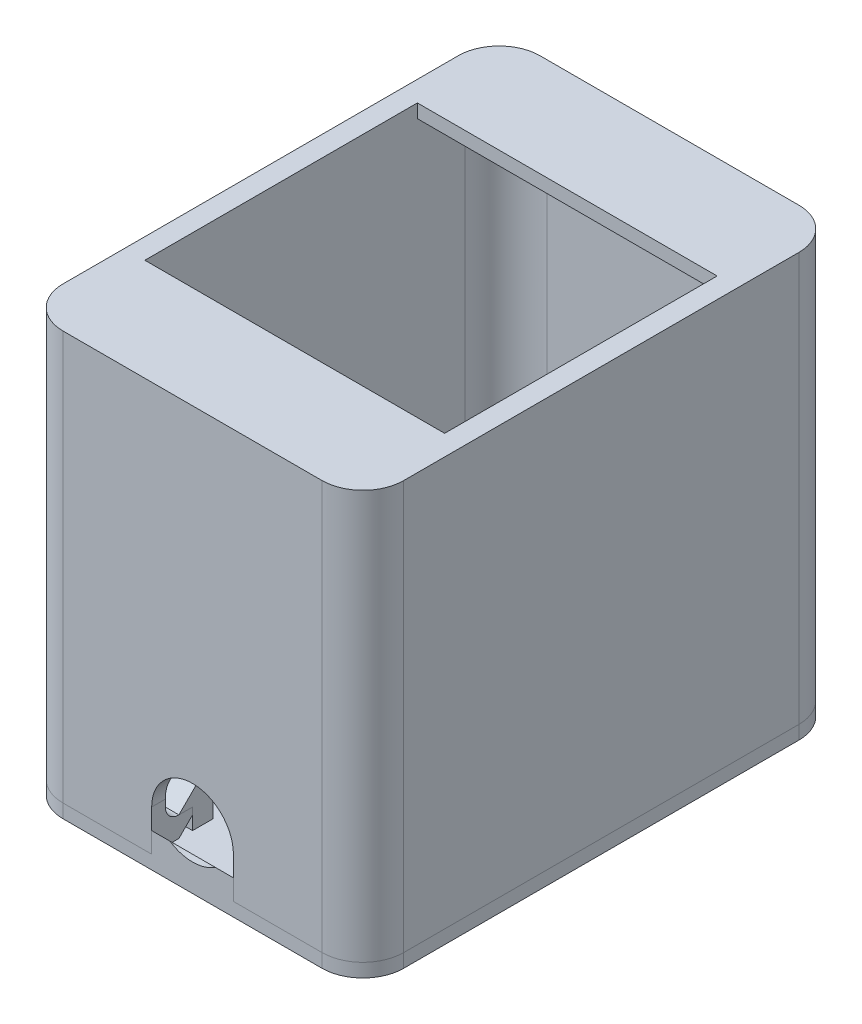
from build123d import *

# Parameters (mm, degrees)
SZKIC1_W                      = 25
SZKIC1_H                      = 35
SZKIC1_W_2                    = 22
SZKIC1_H_2                    = 20
DODANIE_WYCI_GNI_CIE1_DEPTH   = 30
SZKIC2_W                      = 22
SZKIC2_H                      = 4.5
WYTNIJ_WYCI_GNI_CIE1_DEPTH    = 28
SZKIC5_W                      = 22
SZKIC5_H                      = 26.5
WYTNIJ_WYCI_GNI_CIE2_DEPTH    = 2
DODANIE_WYCI_GNI_CIE2_DEPTH   = 22
DODANIE_WYCI_GNI_CIE2_2_DEPTH = 22
SZKIC7_W                      = 25
SZKIC7_H                      = 35
DODANIE_WYCI_GNI_CIE3_DEPTH   = 1
WYTNIJ_WYCI_GNI_CIE3_DEPTH    = 11
WYTNIJ_WYCI_GNI_CIE4_DEPTH    = 11
SZKIC10_W                     = 12
SZKIC10_H                     = 6.631969937
SZKIC10_W_2                   = 6
SZKIC10_H_2                   = 4.921641175
WYTNIJ_WYCI_GNI_CIE5_DEPTH    = 11
DODANIE_WYCI_GNI_CIE5_DEPTH   = 1
DODANIE_WYCI_GNI_CIE6_DEPTH   = 1
SFAZOWANIE1_SIZE              = 1
SFAZOWANIE2_SIZE              = 1
ZAOKR_GLENIE1_R               = 1
ZAOKR_GLENIE2_R               = 3
ZAOKR_GLENIE3_R               = 3
SFAZOWANIE3_SIZE              = 1
ZAOKR_GLENIE4_DEPTH           = 29
WYTNIJ_WYCI_GNI_CIE7_DEPTH    = 4


with BuildPart() as part:
    # Szkic1 → Dodanie-wyciągnięcie1 (new body)
    with BuildSketch(Plane(origin=(0, 0, 0), x_dir=(1, 0, 0), z_dir=(0, 1, 0))):
        Rectangle(SZKIC1_W, SZKIC1_H)
        Rectangle(SZKIC1_W_2, SZKIC1_H_2, mode=Mode.SUBTRACT)
    extrude(amount=DODANIE_WYCI_GNI_CIE1_DEPTH)

    # Szkic2 → Wytnij-wyciągnięcie1 (cut)
    with BuildSketch(Plane.XZ):
        with Locations((0, 12.25)):
            Rectangle(SZKIC2_W, SZKIC2_H)
        with Locations((0, -12.25)):
            Rectangle(SZKIC2_W, SZKIC2_H)
    extrude(amount=-WYTNIJ_WYCI_GNI_CIE1_DEPTH, mode=Mode.SUBTRACT)

    # Szkic5 → Wytnij-wyciągnięcie2 (cut)
    with BuildSketch(Plane(origin=(0, 0, 14.5), x_dir=(-1, 0, 0), z_dir=(0, 0, -1))):
        with Locations((0, 14.75)):
            Rectangle(SZKIC5_W, SZKIC5_H)
    wytnij_wyci_gni_cie2 = extrude(amount=-WYTNIJ_WYCI_GNI_CIE2_DEPTH, mode=Mode.SUBTRACT)

    # Lustro1: Wytnij-wyciągnięcie2 across plane
    add(wytnij_wyci_gni_cie2.mirror(Plane.XY), mode=Mode.SUBTRACT)


with BuildPart() as body_2:
    # Szkic6 → Dodanie-wyciągnięcie2 (new body)
    with BuildSketch(Plane(origin=(-11, 0, 0), x_dir=(0, 0, -1), z_dir=(1, 0, 0))):
        Polygon((-14.5, 1.5), (-15.5, 1.5), (-13, 4), (-13, 0), (-14.5, 0), align=None)
    extrude(amount=DODANIE_WYCI_GNI_CIE2_DEPTH)



with BuildPart() as body_3:
    # Szkic6 → Dodanie-wyci_gni_cie2 2 (new body)
    with BuildSketch(Plane(origin=(-11, 0, 0), x_dir=(0, 0, -1), z_dir=(1, 0, 0))):
        Polygon((14.5, 1.5), (15.5, 1.5), (13, 4), (13, 0), (14.5, 0), align=None)
    extrude(amount=DODANIE_WYCI_GNI_CIE2_2_DEPTH)


with BuildPart() as body_2_1:
    add(body_2.part)

    add(body_3.part)  # Dodanie-wyciągnięcie3 merges body 3
    # Szkic7 → Dodanie-wyciągnięcie3 (add)
    with BuildSketch(Plane.XZ):
        Rectangle(SZKIC7_W, SZKIC7_H)
    extrude(amount=DODANIE_WYCI_GNI_CIE3_DEPTH)


with BuildPart() as wytnij_wyci_gni_cie3_tool:
    # Szkic8 → Wytnij-wyciągnięcie3 (new body)
    with BuildSketch(Plane.XY.offset(17.5)):
        with BuildLine():
            Line((3, 3), (3, 0))
            Line((3, 0), (-3, 0))
            Line((-3, 0), (-3, 3))
            ThreePointArc((-3, 3), (0, 6), (3, 3))
        make_face()
    extrude(amount=-WYTNIJ_WYCI_GNI_CIE3_DEPTH)


with BuildPart() as part_1:
    add(part.part)

    # Wytnij-wyciągnięcie3: cut by wytnij_wyci_gni_cie3_tool
    add(wytnij_wyci_gni_cie3_tool.part, mode=Mode.SUBTRACT)


with BuildPart() as body_2_2:
    add(body_2_1.part)

    # Wytnij-wyciągnięcie3: cut by wytnij_wyci_gni_cie3_tool
    add(wytnij_wyci_gni_cie3_tool.part, mode=Mode.SUBTRACT)


with BuildPart() as wytnij_wyci_gni_cie4_tool:
    # Szkic9 → Wytnij-wyciągnięcie4 (new body)
    with BuildSketch(Plane(origin=(0, 0, -17.5), x_dir=(-1, 0, 0), z_dir=(0, 0, -1))):
        with BuildLine():
            Line((-6, 0), (-6, 3))
            ThreePointArc((-6, 3), (-5.121320344, 5.121320344), (-3, 6))
            Line((-3, 6), (3, 6))
            ThreePointArc((3, 6), (5.121320344, 5.121320344), (6, 3))
            Line((6, 3), (6, 0))
            Line((6, 0), (-6, 0))
        make_face()
    extrude(amount=-WYTNIJ_WYCI_GNI_CIE4_DEPTH)


with BuildPart() as part_2:
    add(part_1.part)

    # Wytnij-wyciągnięcie4: cut by wytnij_wyci_gni_cie4_tool
    add(wytnij_wyci_gni_cie4_tool.part, mode=Mode.SUBTRACT)

    # Sfazowanie2
    sfazowanie2_edges = [part_2.edges().sort_by_distance(p)[0] for p in [
        (8.5, 0, -14.5),
        (-7, 0, 14.5),
        (-8.5, 0, -14.5),
        (7, 0, 14.5),
    ]]
    chamfer(sfazowanie2_edges, length=SFAZOWANIE2_SIZE)

    # Zaokrąglenie1
    zaokr_glenie1_edges = [part_2.edges().sort_by_distance(p)[0] for p in [
        (-8.5, 1.5, -16.5),
        (7, 1.5, 16.5),
        (8.5, 1.5, -16.5),
        (-7, 1.5, 16.5),
    ]]
    fillet(zaokr_glenie1_edges, radius=ZAOKR_GLENIE1_R)

    # Zaokrąglenie2
    zaokr_glenie2_edges = [part_2.edges().sort_by_distance(p)[0] for p in [
        (12.5, 15, 17.5),
        (-12.5, 15, 17.5),
        (-12.5, 15, -17.5),
        (12.5, 15, -17.5),
    ]]
    fillet(zaokr_glenie2_edges, radius=ZAOKR_GLENIE2_R)

    # Sfazowanie3
    sfazowanie3_edges = [part_2.edges().sort_by_distance(p)[0] for p in [
        (0, 28, 10),
        (0, 28, -10),
    ]]
    chamfer(sfazowanie3_edges, length=SFAZOWANIE3_SIZE)

    # Zaokrąglenie4: read off the stored shape, not the designer's step
    # Zaokrąglenie4 outline → Zaokrąglenie4 (add)
    with BuildSketch(Plane(origin=(0, 0, 0), x_dir=(1, 0, 0), z_dir=(0, 1, 0))):
        with BuildLine():
            Line((11, 16.5), (8, 16.5))
            ThreePointArc((8, 16.5), (10.121320344, 15.621320344), (11, 13.5))
            Line((11, 13.5), (11, 16.5))
        make_face()
        with BuildLine():
            Line((-8, 16.5), (-11, 16.5))
            Line((-11, 16.5), (-11, 13.5))
            ThreePointArc((-11, 13.5), (-10.121320344, 15.621320344), (-8, 16.5))
        make_face()
        with BuildLine():
            ThreePointArc((11, -13.5), (10.121320344, -15.621320344), (8, -16.5))
            Line((8, -16.5), (11, -16.5))
            Line((11, -16.5), (11, -13.5))
        make_face()
        with BuildLine():
            Line((-11, -13.5), (-11, -16.5))
            Line((-11, -16.5), (-8, -16.5))
            ThreePointArc((-8, -16.5), (-10.121320344, -15.621320344), (-11, -13.5))
        make_face()
    extrude(amount=ZAOKR_GLENIE4_DEPTH)


with BuildPart() as body_2_3:
    add(body_2_2.part)

    # Wytnij-wyciągnięcie4: cut by wytnij_wyci_gni_cie4_tool
    add(wytnij_wyci_gni_cie4_tool.part, mode=Mode.SUBTRACT)

    # Szkic10 → Wytnij-wyciągnięcie5 (cut)
    with BuildSketch(Plane(origin=(0, 0, 0), x_dir=(1, 0, 0), z_dir=(0, 1, 0))):
        with Locations((0, 14.184015031)):
            Rectangle(SZKIC10_W, SZKIC10_H)
        with Locations((0, -14.039179413)):
            Rectangle(SZKIC10_W_2, SZKIC10_H_2)
    extrude(amount=WYTNIJ_WYCI_GNI_CIE5_DEPTH, mode=Mode.SUBTRACT)

    # Szkic12 → Dodanie-wyciągnięcie5 (add)
    with BuildSketch(Plane.XY.offset(17.5)):
        with BuildLine():
            Line((3, 0), (-3, 0))
            Line((-3, 0), (-3, 1.5))
            Line((-3, 1.5), (-1.658312395, 1.5))
            ThreePointArc((-1.658312395, 1.5), (0, 1), (1.658312395, 1.5))
            Line((1.658312395, 1.5), (3, 1.5))
            Line((3, 1.5), (3, 0))
        make_face()
    extrude(amount=-DODANIE_WYCI_GNI_CIE5_DEPTH)

    # Szkic13 → Dodanie-wyciągnięcie6 (add)
    with BuildSketch(Plane(origin=(0, 0, -17.5), x_dir=(-1, 0, 0), z_dir=(0, 0, -1))):
        with BuildLine():
            Line((-4.658312395, 1.5), (-6, 1.5))
            Line((-6, 1.5), (-6, 0))
            Line((-6, 0), (6, 0))
            Line((6, 0), (6, 1.5))
            Line((6, 1.5), (4.658312395, 1.5))
            ThreePointArc((4.658312395, 1.5), (3, 1), (1.341687605, 1.5))
            Line((1.341687605, 1.5), (-1.341687605, 1.5))
            ThreePointArc((-1.341687605, 1.5), (-3, 1), (-4.658312395, 1.5))
        make_face()
    extrude(amount=-DODANIE_WYCI_GNI_CIE6_DEPTH)

    # Sfazowanie1
    # the kernel refuses this chamfer: 1 mm, written as the material it takes off along each edge
    with BuildSketch(Plane(origin=(-5.571682988, 1.5, 16.5), x_dir=(0, 0, 1), z_dir=(1, 0, 0)), Plane(origin=(-0.913370593, 1.5, 16.5), x_dir=(0, 0, 1), z_dir=(1, 0, 0)), Plane(origin=(-8.571682988, 1.5, -16.5), x_dir=(0, -1, 0), z_dir=(1, 0, 0)), Plane(origin=(2.086629407, 1.5, -16.5), x_dir=(0, -1, 0), z_dir=(1, 0, 0))) as sfazowanie1_piece_1:
        Polygon((SFAZOWANIE1_SIZE, 0), (0, SFAZOWANIE1_SIZE), (0, 0), align=None)
    extrude(amount=6.485053581, mode=Mode.SUBTRACT)
    with BuildSketch(Plane(origin=(-3.913370593, 1.5, -16.5), x_dir=(0, -1, 0), z_dir=(1, 0, 0))) as sfazowanie1_piece_2:
        Polygon((SFAZOWANIE1_SIZE, 0), (0, SFAZOWANIE1_SIZE), (0, 0), align=None)
    extrude(amount=7.826741186, mode=Mode.SUBTRACT)

    # Zaokrąglenie3
    zaokr_glenie3_edges = [body_2_3.edges().sort_by_distance(p)[0] for p in [
        (-12.5, -0.5, 17.5),
        (-12.5, -0.5, -17.5),
        (12.5, -0.5, -17.5),
        (12.5, -0.5, 17.5),
    ]]
    fillet(zaokr_glenie3_edges, radius=ZAOKR_GLENIE3_R)

    # Wytnij-wyciągnięcie7: read off the stored shape, not the designer's step
    # Wytnij-wyciągnięcie7 outline → Wytnij-wyciągnięcie7 (cut)
    with BuildSketch(Plane(origin=(0, 0, 0), x_dir=(1, 0, 0), z_dir=(0, 1, 0))):
        with BuildLine():
            Line((8.894427189, 17), (10.236067977, 15.5))
            ThreePointArc((10.236067977, 15.5), (10.802517077, 14.570466269), (11, 13.5))
            Line((11, 13.5), (11, 15.5))
            Line((11, 15.5), (10.999999995, 17))
            Line((10.999999995, 17), (8.894427189, 17))
        make_face()
        with BuildLine():
            Line((-10.236067977, 15.5), (-8.894427189, 17))
            Line((-8.894427189, 17), (-10.999999998, 17))
            Line((-10.999999998, 17), (-10.999999995, 15.5))
            Line((-10.999999995, 15.5), (-11, 13.5))
            ThreePointArc((-11, 13.5), (-10.802517077, 14.570466269), (-10.236067977, 15.5))
        make_face()
        with BuildLine():
            Line((11, -15.5), (11, -13.5))
            ThreePointArc((11, -13.5), (10.802517077, -14.570466269), (10.236067977, -15.5))
            Line((10.236067977, -15.5), (8.894427189, -17))
            Line((8.894427189, -17), (10.999999998, -17))
            Line((10.999999998, -17), (11, -15.5))
        make_face()
        with BuildLine():
            Line((-10.999999995, -15.5), (-10.999999995, -17))
            Line((-10.999999995, -17), (-8.894427189, -17))
            Line((-8.894427189, -17), (-10.236067977, -15.5))
            ThreePointArc((-10.236067977, -15.5), (-10.802517077, -14.570466269), (-11, -13.5))
            Line((-11, -13.5), (-10.999999995, -15.5))
        make_face()
    extrude(amount=WYTNIJ_WYCI_GNI_CIE7_DEPTH, mode=Mode.SUBTRACT)


solid = Compound([part_2.part, body_2_3.part])
